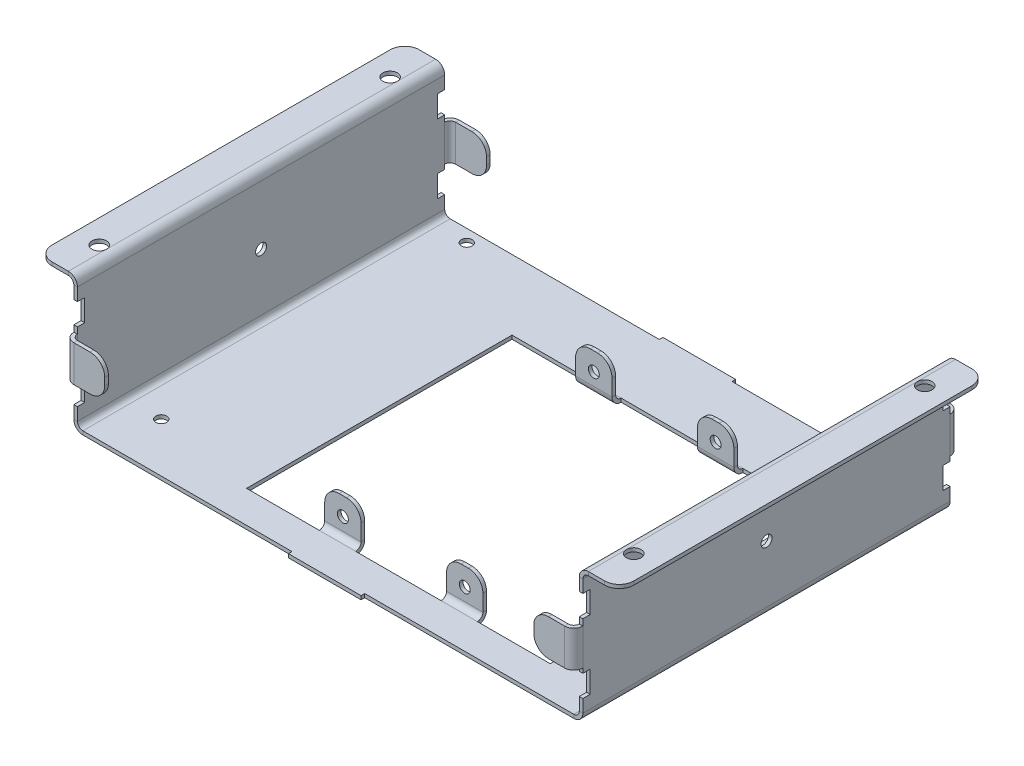
from build123d import *

# Parameters (mm, degrees)
SKETCH2_W                    = 83.5
SKETCH2_H                    = 73
BASE_FLANGE1_DEPTH           = 1
EDGE_FLANGE1_DEPTH           = 10
EDGE_FLANGE1_START           = 1
EDGE_FLANGE1_FLAT_DEPTH      = 1
EDGE_FLANGE1_BEND_DEPTH      = 10
EDGE_FLANGE1_FLAT_2_DEPTH    = 1
EDGE_FLANGE2_DEPTH           = 10
EDGE_FLANGE2_START           = 1
EDGE_FLANGE2_FLAT_DEPTH      = 1
EDGE_FLANGE2_BEND_DEPTH      = 10
EDGE_FLANGE2_FLAT_2_DEPTH    = 1
EDGE_FLANGE3_DEPTH           = 101
EDGE_FLANGE3_BEND_DEPTH      = 101
EDGE_FLANGE5_DEPTH           = 10
EDGE_FLANGE5_START           = 1
EDGE_FLANGE5_FLAT_DEPTH      = 1
EDGE_FLANGE5_BEND_DEPTH      = 10
EDGE_FLANGE5_FLAT_2_DEPTH    = 1
EDGE_FLANGE5_BEND_2_DEPTH    = 10
EDGE_FLANGE5_FLAT_3_DEPTH    = 1
EDGE_FLANGE5_BEND_3_DEPTH    = 10
EDGE_FLANGE5_FLAT_4_DEPTH    = 1
EDGE_FLANGE6_DEPTH           = 101
EDGE_FLANGE6_START           = -1
EDGE_FLANGE6_FLAT_DEPTH      = 1
EDGE_FLANGE6_BEND_DEPTH      = 101
EDGE_FLANGE6_FLAT_2_DEPTH    = 1
F_4_0MM_DOWEL_HOLE1_D        = 4
SKETCH50_W                   = 2
SKETCH50_H                   = 6
CUT_EXTRUDE1_DEPTH           = 143
F_3_0MM_DOWEL_HOLE1_D        = 3
F_3_0MM_DOWEL_HOLE2_D        = 3
F_3_0MM_DOWEL_HOLE2_DEPTH    = 1
F_3_0MM_DOWEL_HOLE3_D        = 3
F_3_0_3_DIAMETER_HOLE1_D     = 3
F_3_0_3_DIAMETER_HOLE1_DEPTH = 1
F_3_0MM_DOWEL_HOLE4_D        = 3


# Sheet-metal steps are written as plain solids
with BuildPart() as part:
    # Sketch2 → Base-Flange1 (new body)
    with BuildSketch(Plane(origin=(0, 0, 0), x_dir=(1, 0, 0), z_dir=(0, 1, 0))):
        Polygon((-67.5, -45), (-10, -45), (-10, -46), (10, -46), (10, -45), (67.5, -45), (67.5, 56), (10, 56), (10, 57), (-10, 57), (-10, 56), (-67.5, 56), align=None)
        with Locations((10.45, 0.3)):
            Rectangle(SKETCH2_W, SKETCH2_H, mode=Mode.SUBTRACT)
    extrude(amount=-BASE_FLANGE1_DEPTH)

    # Edge-Flange1 bend section (across the edge) → Edge-Flange1 (add)
    with BuildSketch(Plane(origin=(32.2, 0, 34.7), x_dir=(0, 0, 1), z_dir=(-1, 0, 0))):
        with BuildLine():
            Line((-1, 1.5), (0, 1.5))
            ThreePointArc((0, 1.5), (0.439339828, 0.439339828), (1.5, 0))
            Line((1.5, 0), (1.5, -1))
            ThreePointArc((1.5, -1), (-0.267766953, -0.267766953), (-1, 1.5))
        make_face()
    extrude(amount=EDGE_FLANGE1_DEPTH)

    # Edge-Flange1 profile (on flange) → Edge-Flange1 flat (add)
    with BuildSketch(Plane(origin=(0, 0, 34.7), x_dir=(-1, 0, 0), z_dir=(0, 0, -1)).offset(EDGE_FLANGE1_START)):
        with BuildLine():
            Line((-32.2, 1.5), (-22.2, 1.5))
            Line((-22.2, 1.5), (-22.2, 6))
            ThreePointArc((-22.2, 6), (-23.371572875, 8.828427125), (-26.2, 10))
            Line((-26.2, 10), (-28.2, 10))
            ThreePointArc((-28.2, 10), (-31.028427125, 8.828427125), (-32.2, 6))
            Line((-32.2, 6), (-32.2, 1.5))
        make_face()
    extrude(amount=-EDGE_FLANGE1_FLAT_DEPTH)

    # Edge-Flange1 bend section 2 (across the edge) → Edge-Flange1 bend (add)
    with BuildSketch(Plane(origin=(22.2, 0, -35.3), x_dir=(0, 0, -1), z_dir=(1, 0, 0))):
        with BuildLine():
            Line((-1, 1.5), (0, 1.5))
            ThreePointArc((0, 1.5), (0.439339828, 0.439339828), (1.5, 0))
            Line((1.5, 0), (1.5, -1))
            ThreePointArc((1.5, -1), (-0.267766953, -0.267766953), (-1, 1.5))
        make_face()
    extrude(amount=EDGE_FLANGE1_BEND_DEPTH)

    # Edge-Flange1 profile 2 (on flange) → Edge-Flange1 flat 2 (add)
    with BuildSketch(Plane.XY.offset(-35.3).offset(EDGE_FLANGE1_START)):
        with BuildLine():
            Line((32.2, 1.5), (32.2, 6))
            ThreePointArc((32.2, 6), (31.028427125, 8.828427125), (28.2, 10))
            Line((28.2, 10), (26.2, 10))
            ThreePointArc((26.2, 10), (23.371572875, 8.828427125), (22.2, 6))
            Line((22.2, 6), (22.2, 1.5))
            Line((22.2, 1.5), (32.2, 1.5))
        make_face()
    extrude(amount=-EDGE_FLANGE1_FLAT_2_DEPTH)

    # Edge-Flange2 bend section (across the edge) → Edge-Flange2 (add)
    with BuildSketch(Plane(origin=(-11.3, 0, -35.3), x_dir=(0, 0, -1), z_dir=(1, 0, 0))):
        with BuildLine():
            Line((-1, 1.5), (0, 1.5))
            ThreePointArc((0, 1.5), (0.439339828, 0.439339828), (1.5, 0))
            Line((1.5, 0), (1.5, -1))
            ThreePointArc((1.5, -1), (-0.267766953, -0.267766953), (-1, 1.5))
        make_face()
    extrude(amount=EDGE_FLANGE2_DEPTH)

    # Edge-Flange2 profile (on flange) → Edge-Flange2 flat (add)
    with BuildSketch(Plane.XY.offset(-35.3).offset(EDGE_FLANGE2_START)):
        with BuildLine():
            Line((-11.3, 1.5), (-1.3, 1.5))
            Line((-1.3, 1.5), (-1.3, 6))
            ThreePointArc((-1.3, 6), (-2.471572875, 8.828427125), (-5.3, 10))
            Line((-5.3, 10), (-7.3, 10))
            ThreePointArc((-7.3, 10), (-10.128427125, 8.828427125), (-11.3, 6))
            Line((-11.3, 6), (-11.3, 1.5))
        make_face()
    extrude(amount=-EDGE_FLANGE2_FLAT_DEPTH)

    # Edge-Flange2 bend section 2 (across the edge) → Edge-Flange2 bend (add)
    with BuildSketch(Plane(origin=(-1.3, 0, 34.7), x_dir=(0, 0, 1), z_dir=(-1, 0, 0))):
        with BuildLine():
            Line((-1, 1.5), (0, 1.5))
            ThreePointArc((0, 1.5), (0.439339828, 0.439339828), (1.5, 0))
            Line((1.5, 0), (1.5, -1))
            ThreePointArc((1.5, -1), (-0.267766953, -0.267766953), (-1, 1.5))
        make_face()
    extrude(amount=EDGE_FLANGE2_BEND_DEPTH)

    # Edge-Flange2 profile 2 (on flange) → Edge-Flange2 flat 2 (add)
    with BuildSketch(Plane(origin=(0, 0, 34.7), x_dir=(-1, 0, 0), z_dir=(0, 0, -1)).offset(EDGE_FLANGE2_START)):
        with BuildLine():
            ThreePointArc((11.3, 6), (10.128427125, 8.828427125), (7.3, 10))
            Line((7.3, 10), (5.3, 10))
            ThreePointArc((5.3, 10), (2.471572875, 8.828427125), (1.3, 6))
            Line((1.3, 6), (1.3, 1.5))
            Line((1.3, 1.5), (11.3, 1.5))
            Line((11.3, 1.5), (11.3, 6))
        make_face()
    extrude(amount=-EDGE_FLANGE2_FLAT_2_DEPTH)

    # Edge-Flange3 section (across the edge) → Edge-Flange3 (add)
    with BuildSketch(Plane(origin=(-69, 0, -56), x_dir=(1, 0, 0), z_dir=(0, 0, 1))):
        with BuildLine():
            Line((-1, 1.5), (-1, 33.5))
            Line((-1, 33.5), (0, 33.5))
            Line((0, 33.5), (0, 1.5))
            ThreePointArc((0, 1.5), (0.439339828, 0.439339828), (1.5, 0))
            Line((1.5, 0), (1.5, -1))
            ThreePointArc((1.5, -1), (-0.267766953, -0.267766953), (-1, 1.5))
        make_face()
    extrude(amount=EDGE_FLANGE3_DEPTH)

    # Edge-Flange3 section 2 (across the edge) → Edge-Flange3 bend (add)
    with BuildSketch(Plane(origin=(69, 0, 45), x_dir=(-1, 0, 0), z_dir=(0, 0, -1))):
        with BuildLine():
            Line((-1, 1.5), (-1, 33.5))
            Line((-1, 33.5), (0, 33.5))
            Line((0, 33.5), (0, 1.5))
            ThreePointArc((0, 1.5), (0.439339828, 0.439339828), (1.5, 0))
            Line((1.5, 0), (1.5, -1))
            ThreePointArc((1.5, -1), (-0.267766953, -0.267766953), (-1, 1.5))
        make_face()
    extrude(amount=EDGE_FLANGE3_BEND_DEPTH)

    # Edge-Flange5 bend section (across the edge) → Edge-Flange5 (add)
    with BuildSketch(Plane(origin=(69, 12.25, 46.5), x_dir=(0, 0, -1), z_dir=(0, 1, 0))):
        with BuildLine():
            Line((-1, 1.5), (0, 1.5))
            ThreePointArc((0, 1.5), (0.439339828, 0.439339828), (1.5, 0))
            Line((1.5, 0), (1.5, -1))
            ThreePointArc((1.5, -1), (-0.267766953, -0.267766953), (-1, 1.5))
        make_face()
    extrude(amount=EDGE_FLANGE5_DEPTH)

    # Edge-Flange5 profile (on flange) → Edge-Flange5 flat (add)
    with BuildSketch(Plane(origin=(69, 0, 46.5), x_dir=(0, 1, 0), z_dir=(0, 0, 1)).offset(EDGE_FLANGE5_START)):
        with BuildLine():
            Line((22.25, 1.5), (22.25, 6))
            ThreePointArc((22.25, 6), (21.078427125, 8.828427125), (18.25, 10))
            Line((18.25, 10), (16.25, 10))
            ThreePointArc((16.25, 10), (13.421572875, 8.828427125), (12.25, 6))
            Line((12.25, 6), (12.25, 1.5))
            Line((12.25, 1.5), (22.25, 1.5))
        make_face()
    extrude(amount=-EDGE_FLANGE5_FLAT_DEPTH)

    # Edge-Flange5 bend section 2 (across the edge) → Edge-Flange5 bend (add)
    with BuildSketch(Plane(origin=(69, 22.25, -57.5), x_dir=(0, 0, 1), z_dir=(0, -1, 0))):
        with BuildLine():
            Line((-1, 1.5), (0, 1.5))
            ThreePointArc((0, 1.5), (0.439339828, 0.439339828), (1.5, 0))
            Line((1.5, 0), (1.5, -1))
            ThreePointArc((1.5, -1), (-0.267766953, -0.267766953), (-1, 1.5))
        make_face()
    extrude(amount=EDGE_FLANGE5_BEND_DEPTH)

    # Edge-Flange5 profile 2 (on flange) → Edge-Flange5 flat 2 (add)
    with BuildSketch(Plane(origin=(69, 0, -57.5), x_dir=(0, -1, 0), z_dir=(0, 0, -1)).offset(EDGE_FLANGE5_START)):
        with BuildLine():
            ThreePointArc((-12.25, 6), (-13.421572875, 8.828427125), (-16.25, 10))
            Line((-16.25, 10), (-18.25, 10))
            ThreePointArc((-18.25, 10), (-21.078427125, 8.828427125), (-22.25, 6))
            Line((-22.25, 6), (-22.25, 1.5))
            Line((-22.25, 1.5), (-12.25, 1.5))
            Line((-12.25, 1.5), (-12.25, 6))
        make_face()
    extrude(amount=-EDGE_FLANGE5_FLAT_2_DEPTH)

    # Edge-Flange5 bend section 3 (across the edge) → Edge-Flange5 bend 2 (add)
    with BuildSketch(Plane(origin=(-69, 22.25, 46.5), x_dir=(0, 0, -1), z_dir=(0, -1, 0))):
        with BuildLine():
            Line((-1, 1.5), (0, 1.5))
            ThreePointArc((0, 1.5), (0.439339828, 0.439339828), (1.5, 0))
            Line((1.5, 0), (1.5, -1))
            ThreePointArc((1.5, -1), (-0.267766953, -0.267766953), (-1, 1.5))
        make_face()
    extrude(amount=EDGE_FLANGE5_BEND_2_DEPTH)

    # Edge-Flange5 profile 3 (on flange) → Edge-Flange5 flat 3 (add)
    with BuildSketch(Plane(origin=(-69, 0, 46.5), x_dir=(0, -1, 0), z_dir=(0, 0, 1)).offset(EDGE_FLANGE5_START)):
        with BuildLine():
            Line((-12.25, 1.5), (-12.25, 6))
            ThreePointArc((-12.25, 6), (-13.421572875, 8.828427125), (-16.25, 10))
            Line((-16.25, 10), (-18.25, 10))
            ThreePointArc((-18.25, 10), (-21.078427125, 8.828427125), (-22.25, 6))
            Line((-22.25, 6), (-22.25, 1.5))
            Line((-22.25, 1.5), (-12.25, 1.5))
        make_face()
    extrude(amount=-EDGE_FLANGE5_FLAT_3_DEPTH)

    # Edge-Flange5 bend section 4 (across the edge) → Edge-Flange5 bend 3 (add)
    with BuildSketch(Plane(origin=(-69, 12.25, -57.5), x_dir=(0, 0, 1), z_dir=(0, 1, 0))):
        with BuildLine():
            Line((-1, 1.5), (0, 1.5))
            ThreePointArc((0, 1.5), (0.439339828, 0.439339828), (1.5, 0))
            Line((1.5, 0), (1.5, -1))
            ThreePointArc((1.5, -1), (-0.267766953, -0.267766953), (-1, 1.5))
        make_face()
    extrude(amount=EDGE_FLANGE5_BEND_3_DEPTH)

    # Edge-Flange5 profile 4 (on flange) → Edge-Flange5 flat 4 (add)
    with BuildSketch(Plane(origin=(-69, 0, -57.5), x_dir=(0, 1, 0), z_dir=(0, 0, -1)).offset(EDGE_FLANGE5_START)):
        with BuildLine():
            Line((22.25, 1.5), (22.25, 6))
            ThreePointArc((22.25, 6), (21.078427125, 8.828427125), (18.25, 10))
            Line((18.25, 10), (16.25, 10))
            ThreePointArc((16.25, 10), (13.421572875, 8.828427125), (12.25, 6))
            Line((12.25, 6), (12.25, 1.5))
            Line((12.25, 1.5), (22.25, 1.5))
        make_face()
    extrude(amount=-EDGE_FLANGE5_FLAT_4_DEPTH)

    # Edge-Flange6 bend section (across the edge) → Edge-Flange6 (add)
    with BuildSketch(Plane(origin=(70, 35, -56), x_dir=(0, -1, 0), z_dir=(0, 0, 1))):
        with BuildLine():
            Line((-1, 1.5), (0, 1.5))
            ThreePointArc((0, 1.5), (0.439339828, 0.439339828), (1.5, 0))
            Line((1.5, 0), (1.5, -1))
            ThreePointArc((1.5, -1), (-0.267766953, -0.267766953), (-1, 1.5))
        make_face()
    extrude(amount=EDGE_FLANGE6_DEPTH)

    # Edge-Flange6 profile (on flange) → Edge-Flange6 flat (add)
    with BuildSketch(Plane(origin=(70, 35, 0), x_dir=(0, 0, -1), z_dir=(0, -1, 0)).offset(EDGE_FLANGE6_START)):
        with BuildLine():
            Line((-45, 1.5), (56, 1.5))
            Line((56, 1.5), (56, 6))
            ThreePointArc((56, 6), (54.828427125, 8.828427125), (52, 10))
            Line((52, 10), (-41, 10))
            ThreePointArc((-41, 10), (-43.828427125, 8.828427125), (-45, 6))
            Line((-45, 6), (-45, 1.5))
        make_face()
    extrude(amount=EDGE_FLANGE6_FLAT_DEPTH)

    # Edge-Flange6 bend section 2 (across the edge) → Edge-Flange6 bend (add)
    with BuildSketch(Plane(origin=(-70, 35, 45), x_dir=(0, -1, 0), z_dir=(0, 0, -1))):
        with BuildLine():
            Line((-1, 1.5), (0, 1.5))
            ThreePointArc((0, 1.5), (0.439339828, 0.439339828), (1.5, 0))
            Line((1.5, 0), (1.5, -1))
            ThreePointArc((1.5, -1), (-0.267766953, -0.267766953), (-1, 1.5))
        make_face()
    extrude(amount=EDGE_FLANGE6_BEND_DEPTH)

    # Edge-Flange6 profile 2 (on flange) → Edge-Flange6 flat 2 (add)
    with BuildSketch(Plane(origin=(-70, 35, 0), x_dir=(0, 0, 1), z_dir=(0, -1, 0)).offset(EDGE_FLANGE6_START)):
        with BuildLine():
            Line((41, 10), (-52, 10))
            ThreePointArc((-52, 10), (-54.828427125, 8.828427125), (-56, 6))
            Line((-56, 6), (-56, 1.5))
            Line((-56, 1.5), (45, 1.5))
            Line((45, 1.5), (45, 6))
            ThreePointArc((45, 6), (43.828427125, 8.828427125), (41, 10))
        make_face()
    extrude(amount=EDGE_FLANGE6_FLAT_2_DEPTH)

    # Ø4.0mm Dowel Hole1 (through all)
    with Locations(Plane(origin=(0, 36, 0), x_dir=(1, 0, 0), z_dir=(0, 1, 0))):
        with Locations((-73.5, 45.5), (-73.5, -34.5), (73.5, -34.5), (73.5, 45.5)):
            Hole(F_4_0MM_DOWEL_HOLE1_D / 2)

    # Sketch50 → Cut-Extrude1 (cut)
    with BuildSketch(Plane.ZY.offset(70)):
        with Locations((-55, 27)):
            Rectangle(SKETCH50_W, SKETCH50_H)
        with Locations((-55, 8)):
            Rectangle(SKETCH50_W, SKETCH50_H)
        with Locations((44, 8)):
            Rectangle(SKETCH50_W, SKETCH50_H)
        with Locations((44, 27)):
            Rectangle(SKETCH50_W, SKETCH50_H)
    extrude(amount=-CUT_EXTRUDE1_DEPTH, mode=Mode.SUBTRACT)

    # Ø3.0mm Dowel Hole1 (through all)
    with Locations(Plane(origin=(0, 0, 0), x_dir=(1, 0, 0), z_dir=(0, 1, 0))):
        with Locations((-59.497386186, 52.548877367), (59.502629814, 52.548877367), (-59.497386186, -31.451107033), (59.502629814, -31.451107033)):
            Hole(F_3_0MM_DOWEL_HOLE1_D / 2)

    # Ø3.0mm Dowel Hole2
    with Locations(Plane(origin=(0, 0, -35.3), x_dir=(-1, 0, 0), z_dir=(0, 0, -1))):
        with Locations((-27.2, 5), (6.3, 5)):
            Hole(F_3_0MM_DOWEL_HOLE2_D / 2, depth=F_3_0MM_DOWEL_HOLE2_DEPTH)

    # Ø3.0mm Dowel Hole3 (through all)
    with Locations(Plane.XY.offset(34.7)):
        with Locations((-6.3, 5), (27.2, 5)):
            Hole(F_3_0MM_DOWEL_HOLE3_D / 2)

    # Ø3.0 (3) Diameter Hole1
    with Locations(Plane(origin=(70, 0, 0), x_dir=(0, 0, -1), z_dir=(1, 0, 0))):
        with Locations((5.5, 17.25)):
            Hole(F_3_0_3_DIAMETER_HOLE1_D / 2, depth=F_3_0_3_DIAMETER_HOLE1_DEPTH)

    # Ø3.0mm Dowel Hole4 (through all)
    with Locations(Plane.ZY.offset(70)):
        with Locations((-5.5, 17.25)):
            Hole(F_3_0MM_DOWEL_HOLE4_D / 2)


solid = part.part
